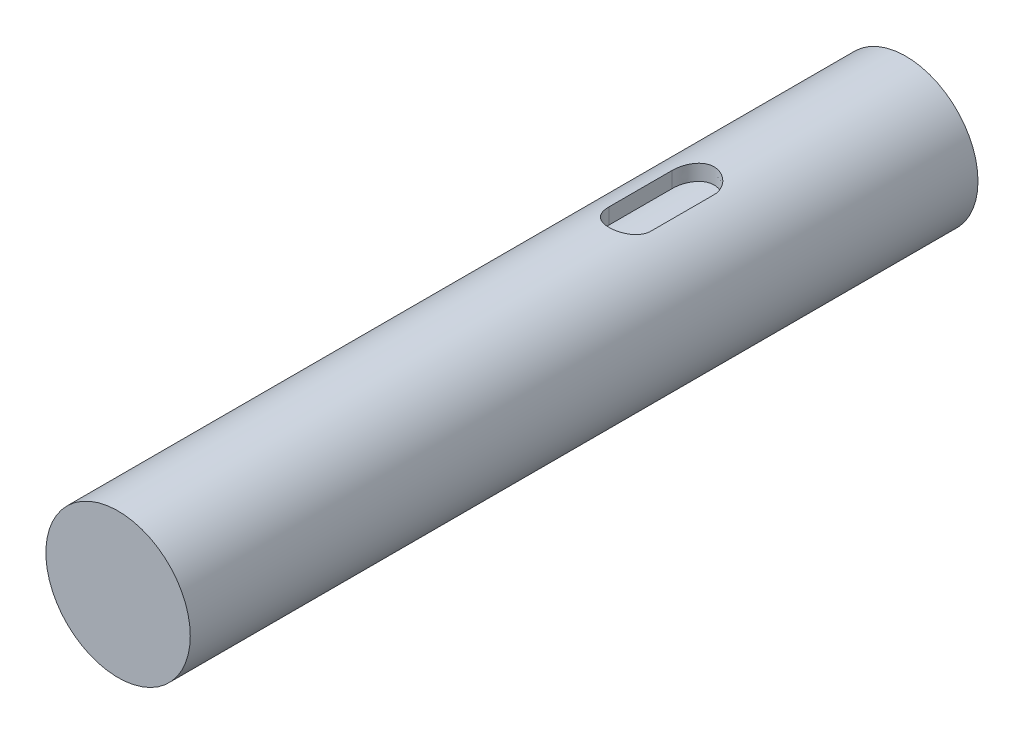
from build123d import *

# Parameters (mm, degrees)
SKETCH1_R            = 27.5
BOSS_EXTRUDE1_DEPTH  = 300
CUT_EXTRUDE1_START   = 21.500000052
CUT_EXTRUDE1_DEPTH   = 7.499999948
CUT_EXTRUDE1_START_2 = 20.310644134
CUT_EXTRUDE1_2_DEPTH = 1.189355918
CUT_EXTRUDE1_START_3 = 72.999999946
CUT_EXTRUDE1_3_DEPTH = 40.000000108


with BuildPart() as part:
    # Sketch1 → Boss-Extrude1 (new body)
    with BuildSketch(Plane.XY):
        Circle(SKETCH1_R)
    extrude(amount=BOSS_EXTRUDE1_DEPTH)

    # Cut-Extrude1: read off the stored shape, not the designer's step
    # Cut-Extrude1 outline → Cut-Extrude1 (cut)
    with BuildSketch(Plane(origin=(0, 0, 0), x_dir=(1, 0, 0), z_dir=(0, 1, 0)).offset(CUT_EXTRUDE1_START)):
        with BuildLine():
            Line((-8, -81), (-8, -105))
            add(Edge.make_bspline(
                [(-8, -105), (-8, -106.063035006), (-7.788701178, -107.105523906), (-6.984119374, -109.039699683), (-6.390533847, -109.923095258), (-4.923786882, -111.390000979), (-4.036294094, -111.985161837), (-2.113824822, -112.785621396), (-1.057490709, -112.998980405), (1.04200741, -113.001012103), (2.09275073, -112.792846435), (4.037391687, -111.986238583), (4.915900837, -111.397309074), (7.133041074, -109.181662675), (8, -107.126189888), (8, -105)],
                knots=[0, 0, 0, 0, 0.125, 0.125, 0.25, 0.25, 0.375, 0.375, 0.5, 0.5, 0.625, 0.625, 0.75, 0.75, 1, 1, 1, 1], degree=3))
            Line((8, -105), (8, -81))
            add(Edge.make_bspline(
                [(8, -81), (8, -79.936964994), (7.788701178, -78.894476094), (6.984119374, -76.960300317), (6.390533847, -76.076904742), (4.923786882, -74.609999021), (4.036294094, -74.014838163), (2.113824822, -73.214378604), (1.057490709, -73.001019595), (-1.04200741, -72.998987897), (-2.09275073, -73.207153565), (-4.037391687, -74.013761417), (-4.915900837, -74.602690926), (-7.133041074, -76.818337325), (-8, -78.873810112), (-8, -81)],
                knots=[0, 0, 0, 0, 0.125, 0.125, 0.25, 0.25, 0.375, 0.375, 0.5, 0.5, 0.625, 0.625, 0.75, 0.75, 1, 1, 1, 1], degree=3))
        make_face()
    extrude(amount=CUT_EXTRUDE1_DEPTH, mode=Mode.SUBTRACT)

    # Cut-Extrude1 2 outline → Cut-Extrude1 2 (cut)
    with BuildSketch(Plane(origin=(0, 0, 0), x_dir=(1, 0, 0), z_dir=(0, 1, 0)).offset(CUT_EXTRUDE1_START_2)):
        with BuildLine():
            Line((-8, -81), (-8, -105))
            add(Edge.make_bspline(
                [(-8, -105), (-8, -106.063035006), (-7.788701178, -107.105523906), (-6.984119374, -109.039699683), (-6.390533847, -109.923095258), (-4.923786882, -111.390000979), (-4.036294094, -111.985161837), (-2.113824822, -112.785621396), (-1.057490709, -112.998980405), (1.04200741, -113.001012103), (2.09275073, -112.792846435), (4.037391687, -111.986238583), (4.915900837, -111.397309074), (7.133041074, -109.181662675), (8, -107.126189888), (8, -105)],
                knots=[0, 0, 0, 0, 0.125, 0.125, 0.25, 0.25, 0.375, 0.375, 0.5, 0.5, 0.625, 0.625, 0.75, 0.75, 1, 1, 1, 1], degree=3))
            Line((8, -105), (8, -81))
            add(Edge.make_bspline(
                [(8, -81), (8, -79.936964994), (7.788701178, -78.894476094), (6.984119374, -76.960300317), (6.390533847, -76.076904742), (4.923786882, -74.609999021), (4.036294094, -74.014838163), (2.113824822, -73.214378604), (1.057490709, -73.001019595), (-1.04200741, -72.998987897), (-2.09275073, -73.207153565), (-4.037391687, -74.013761417), (-4.915900837, -74.602690926), (-7.133041074, -76.818337325), (-8, -78.873810112), (-8, -81)],
                knots=[0, 0, 0, 0, 0.125, 0.125, 0.25, 0.25, 0.375, 0.375, 0.5, 0.5, 0.625, 0.625, 0.75, 0.75, 1, 1, 1, 1], degree=3))
        make_face()
    extrude(amount=CUT_EXTRUDE1_2_DEPTH, mode=Mode.SUBTRACT)

    # Cut-Extrude1 3 outline → Cut-Extrude1 3 (add)
    with BuildSketch(Plane.XY.offset(CUT_EXTRUDE1_START_3)):
        with BuildLine():
            ThreePointArc((8, 20.310644234), (0, 21.5), (-8, 20.310644234))
            Line((-8, 20.310644234), (8, 20.310644234))
        make_face()
    extrude(amount=CUT_EXTRUDE1_3_DEPTH)


solid = part.part
